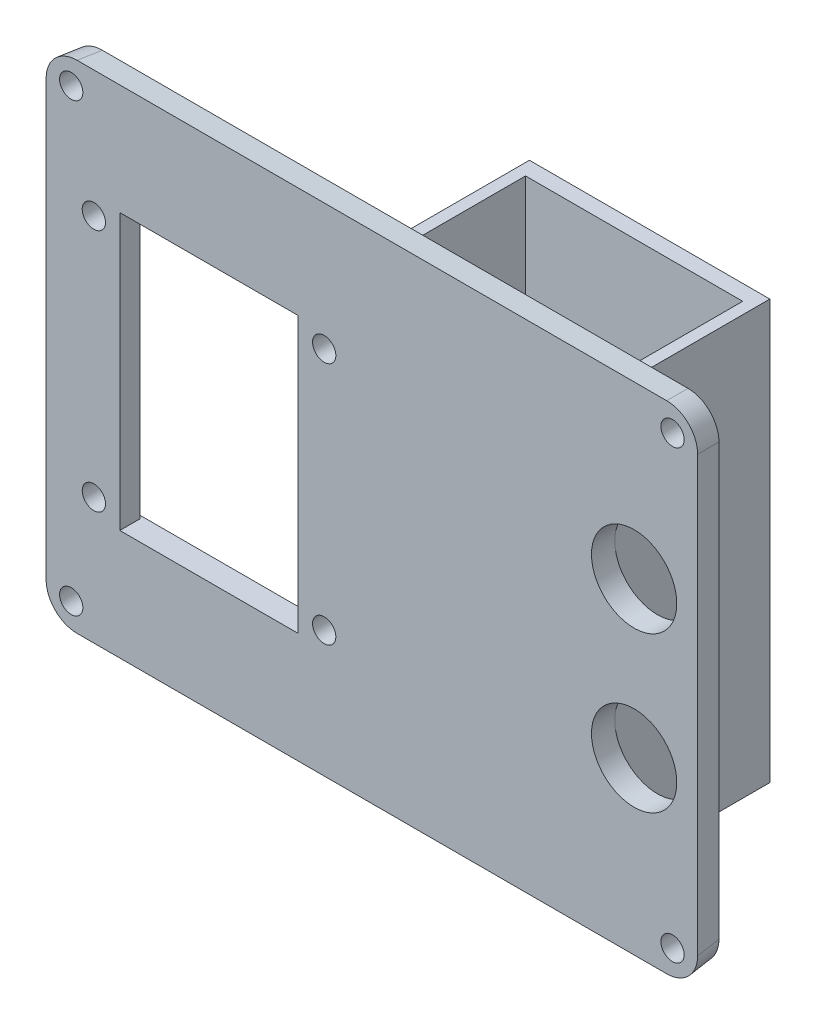
from build123d import *

# Parameters (mm, degrees)
SKETCH3_R               = 1.5
CUT_EXTRUDE1_DEPTH      = 10
MIRROR2_COPY_1_SKETCH_R = 1.5
MIRROR2_COPY_1_DEPTH    = 10
FILLET1_R               = 4
SKETCH4_W               = 23
SKETCH4_H               = 17.75
SKETCH4_R               = 1.5
CUT_EXTRUDE2_DEPTH      = 2.6
SKETCH5_W               = 33.7
SKETCH5_H               = 17.75
CUT_EXTRUDE3_DEPTH      = 0.4
BOSS_EXTRUDE1_DEPTH     = 18
SKETCH7_W               = 31
SKETCH7_H               = 54
BOSS_EXTRUDE2_DEPTH     = 2
SKETCH8_W               = 14
SKETCH8_H               = 18
CUT_EXTRUDE4_DEPTH      = 12
CUT_EXTRUDE6_START      = -12
SKETCH9_R               = 5.5
CUT_EXTRUDE6_DEPTH      = 69.462376985
CUT_EXTRUDE8_DEPTH      = 22
SKETCH11_W              = 12
SKETCH11_H              = 2
CUT_EXTRUDE9_DEPTH      = 0.4
FILLET2_R               = 2


with BuildPart() as part:
    # Sketch2 → Loft1 section 0
    with BuildSketch(Plane.XY.offset(3)):
        with BuildLine():
            Line((-42, -32), (42, -32))
            Line((42, -32), (42, 32))
            Line((42, 32), (-42, 32))
            Line((-42, 32), (-42, -32))
        make_face()
    # Sketch1 → Loft1 section 1
    with BuildSketch(Plane.XY):
        with BuildLine():
            Line((-41.75, -31.75), (41.75, -31.75))
            Line((41.75, -31.75), (41.75, 31.75))
            Line((41.75, 31.75), (-41.75, 31.75))
            Line((-41.75, 31.75), (-41.75, -31.75))
        make_face()
    loft()

    # Sketch3 → Cut-Extrude1 (cut)
    with BuildSketch(Plane(origin=(0, 0, 0), x_dir=(-1, 0, 0), z_dir=(0, 0, -1))):
        with Locations((38.767766953, -28.767766953)):
            Circle(SKETCH3_R)
    cut_extrude1 = extrude(amount=-CUT_EXTRUDE1_DEPTH, mode=Mode.SUBTRACT)

    # Mirror1: Cut-Extrude1 across plane
    add(cut_extrude1.mirror(Plane(origin=(0, 0, 0), x_dir=(0, 0, 1), z_dir=(1, 0, 0))), mode=Mode.SUBTRACT)

    # Mirror2: Cut-Extrude1 across plane
    add(cut_extrude1.mirror(Plane.ZX), mode=Mode.SUBTRACT)

    # Mirror2 copy 1 sketch → Mirror2 copy 1 (cut)
    with BuildSketch(Plane(origin=(0, 0, 0), x_dir=(1, 0, 0), z_dir=(0, 0, -1))):
        with Locations((38.767766953, -28.767766953)):
            Circle(MIRROR2_COPY_1_SKETCH_R)
    extrude(amount=-MIRROR2_COPY_1_DEPTH, mode=Mode.SUBTRACT)

    # Fillet1
    fillet1_edges = [part.edges().sort_by_distance(p)[0] for p in [
        (-41.875, 31.875, 1.5),
        (41.875, 31.875, 1.5),
        (41.875, -31.875, 1.5),
        (-41.875, -31.875, 1.5),
    ]]
    fillet(fillet1_edges, radius=FILLET1_R)

    # Sketch4 → Cut-Extrude2 (cut)
    with BuildSketch(Plane.XY.offset(3)):
        with Locations((-21, 8.875)):
            Rectangle(SKETCH4_W, SKETCH4_H)
        with Locations((-21, -8.875)):
            Rectangle(SKETCH4_W, SKETCH4_H)
        with Locations((-35.85, 15.71)):
            Circle(SKETCH4_R)
        with Locations((-6.15, -15.71)):
            Circle(SKETCH4_R)
        with Locations((-6.15, 15.71)):
            Circle(SKETCH4_R)
        with Locations(Location((-35.85, -15.71, 0), (0, 0, 180))):
            Circle(SKETCH4_R)
    extrude(amount=-CUT_EXTRUDE2_DEPTH, mode=Mode.SUBTRACT)

    # Sketch5 → Cut-Extrude3 (cut)
    with BuildSketch(Plane(origin=(0, 0, 0), x_dir=(-1, 0, 0), z_dir=(0, 0, -1))):
        with Locations((20.875, -8.875)):
            Rectangle(SKETCH5_W, SKETCH5_H)
        with Locations((20.875, 8.875)):
            Rectangle(SKETCH5_W, SKETCH5_H)
    extrude(amount=-CUT_EXTRUDE3_DEPTH, mode=Mode.SUBTRACT)

    # Sketch6 → Boss-Extrude1 (add)
    with BuildSketch(Plane(origin=(0, 0, 0), x_dir=(-1, 0, 0), z_dir=(0, 0, -1))):
        Polygon((2.684756285, -27), (2.684756285, 0), (1.184756285, 0), (1.184756285, -25), (-26.815243715, -25), (-26.815243715, 0), (-28.315243715, 0), (-28.315243715, -27), align=None)
        Polygon((2.684756285, 0), (2.684756285, 27), (-28.315243715, 27), (-28.315243715, 0), (-26.815243715, 0), (-26.815243715, 25), (1.184756285, 25), (1.184756285, 0), align=None)
    extrude(amount=BOSS_EXTRUDE1_DEPTH)

    # Sketch7 → Boss-Extrude2 (add)
    with BuildSketch(Plane(origin=(0, 0, -18), x_dir=(-1, 0, 0), z_dir=(0, 0, -1))):
        with Locations((-12.815243715, 0)):
            Rectangle(SKETCH7_W, SKETCH7_H)
    extrude(amount=BOSS_EXTRUDE2_DEPTH)

    # Sketch8 → Cut-Extrude4 (cut)
    with BuildSketch(Plane(origin=(0, 27, 0), x_dir=(1, 0, 0), z_dir=(0, 1, 0))):
        with Locations((5.815243715, 9)):
            Rectangle(SKETCH8_W, SKETCH8_H)
        with Locations((19.815243715, 9)):
            Rectangle(SKETCH8_W, SKETCH8_H)
    extrude(amount=-CUT_EXTRUDE4_DEPTH, mode=Mode.SUBTRACT)

    # Sketch9 → Cut-Extrude6 (cut)
    with BuildSketch(Plane(origin=(0, 0, 0), x_dir=(-1, 0, 0), z_dir=(0, 0, -1)).offset(CUT_EXTRUDE6_START)):
        with Locations((-33.815243715, -10)):
            Circle(SKETCH9_R)
    cut_extrude6 = extrude(amount=CUT_EXTRUDE6_DEPTH, mode=Mode.SUBTRACT)

    # Mirror3: Cut-Extrude6 across plane
    add(cut_extrude6.mirror(Plane.ZX), mode=Mode.SUBTRACT)

    # Sketch10 → Cut-Extrude8 (cut)
    with BuildSketch(Plane(origin=(0, -25, 0), x_dir=(1, 0, 0), z_dir=(0, 1, 0))):
        Polygon((15.815243715, 18), (21.815243715, 18), (21.815243715, 11), (9.815243715, 11), (9.815243715, 18), align=None)
    extrude(amount=-CUT_EXTRUDE8_DEPTH, mode=Mode.SUBTRACT)

    # Sketch11 → Cut-Extrude9 (cut)
    with BuildSketch(Plane.XY.offset(-18)):
        with Locations((15.815243715, -26)):
            Rectangle(SKETCH11_W, SKETCH11_H)
    extrude(amount=-CUT_EXTRUDE9_DEPTH, mode=Mode.SUBTRACT)

    # Fillet2
    # the kernel refuses this fillet: 2 mm, written as the material it adds along each edge
    with BuildSketch(Plane(origin=(21.815243715, -25, -11), x_dir=(0, 0, -1), z_dir=(0, -1, 0)), Plane(origin=(9.815243715, -27, -18.4), x_dir=(1, 0, 0), z_dir=(0, 1, 0))) as fillet2_piece_1:
        with BuildLine():
            CenterArc((FILLET2_R, -FILLET2_R), FILLET2_R, 90, 90)
            Line((0, -FILLET2_R), (0, 0))
            Line((0, 0), (FILLET2_R, 0))
        make_face()
    extrude(amount=2)
    with BuildSketch(Plane(origin=(9.815243715, -25, -11), x_dir=(0, 0, -1), z_dir=(0, -1, 0)), Plane(origin=(21.815243715, -25, -18.4), x_dir=(0, 0, 1), z_dir=(0, -1, 0))) as fillet2_piece_2:
        with BuildLine():
            CenterArc((FILLET2_R, FILLET2_R), FILLET2_R, 180, 90)
            Line((0, FILLET2_R), (0, 0))
            Line((0, 0), (FILLET2_R, 0))
        make_face()
    extrude(amount=2)


solid = part.part
